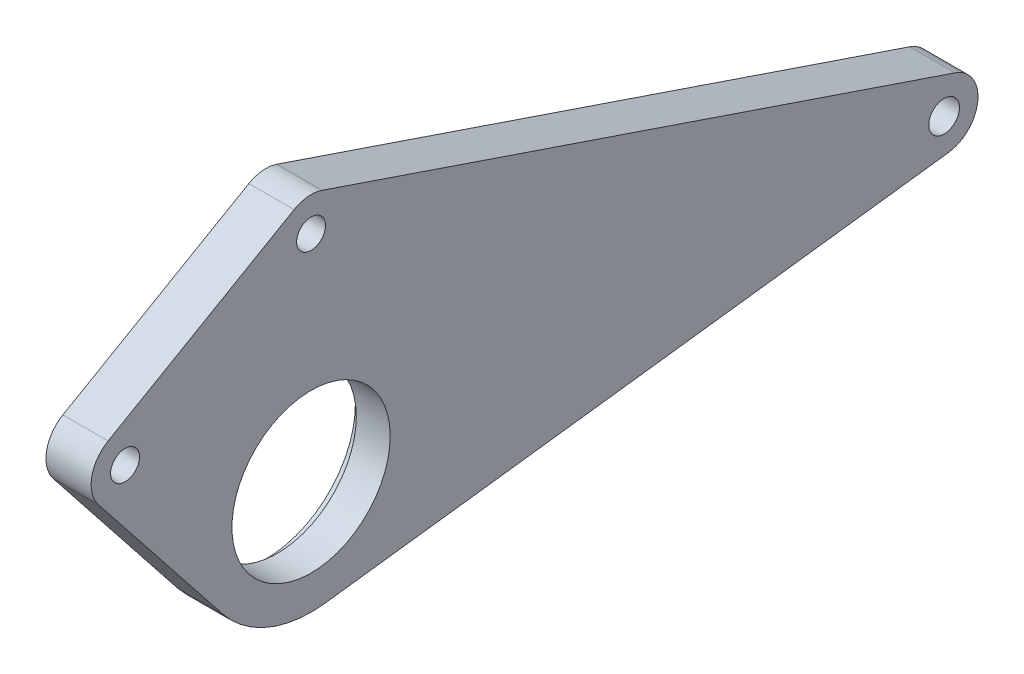
from build123d import *

# Parameters (mm, degrees)
SKETCH1_R           = 2.159
SKETCH1_R_2         = 11.1125
SKETCH1_R_3         = 2.032
BOSS_EXTRUDE1_DEPTH = 6.35
SKETCH2_R           = 12.573
CUT_EXTRUDE1_DEPTH  = 1.5875


with BuildPart() as part:
    # Sketch1 → Boss-Extrude1 (new body)
    with BuildSketch(Plane(origin=(0, 0, 0), x_dir=(0, 0, -1), z_dir=(1, 0, 0))):
        with BuildLine():
            Line((1.530173842, 4.50998606), (-87.369826158, 34.67248606))
            ThreePointArc((-87.369826158, 34.67248606), (-89.367164793, 34.902031971), (-91.28125, 34.286945986))
            Line((-91.28125, 34.286945986), (-117.402741242, 19.205695986))
            ThreePointArc((-117.402741242, 19.205695986), (-119.699491914, 15.974399462), (-118.754774559, 12.124224142))
            Line((-118.754774559, 12.124224142), (-101.344277724, -9.85675286))
            ThreePointArc((-101.344277724, -9.85675286), (-94.903034277, -14.696230961), (-86.915625, -15.750488274))
            Line((-86.915625, -15.750488274), (0.5953125, -4.725146482))
            ThreePointArc((0.5953125, -4.725146482), (4.738284639, -0.479650846), (1.530173842, 4.50998606))
        make_face()
        Circle(SKETCH1_R, mode=Mode.SUBTRACT)
        with Locations((-88.9, 0)):
            Circle(SKETCH1_R_2, mode=Mode.SUBTRACT)
        with Locations((-88.9, 30.1625)):
            Circle(SKETCH1_R_3, mode=Mode.SUBTRACT)
        with Locations((-115.021491242, 15.08125)):
            Circle(SKETCH1_R_3, mode=Mode.SUBTRACT)
    extrude(amount=BOSS_EXTRUDE1_DEPTH)

    # Sketch2 → Cut-Extrude1 (cut)
    with BuildSketch(Plane(origin=(6.35, 0, 0), x_dir=(0, 0, -1), z_dir=(1, 0, 0))):
        with Locations((-88.9, 0)):
            Circle(SKETCH2_R)
    extrude(amount=-CUT_EXTRUDE1_DEPTH, mode=Mode.SUBTRACT)


with BuildPart() as body_2:
    # Mirror1: mirrored copy
    add(part.part.mirror(Plane(origin=(6.35, 0, 0), x_dir=(0, 0, 1), z_dir=(1, 0, 0))))


solid = body_2.part
